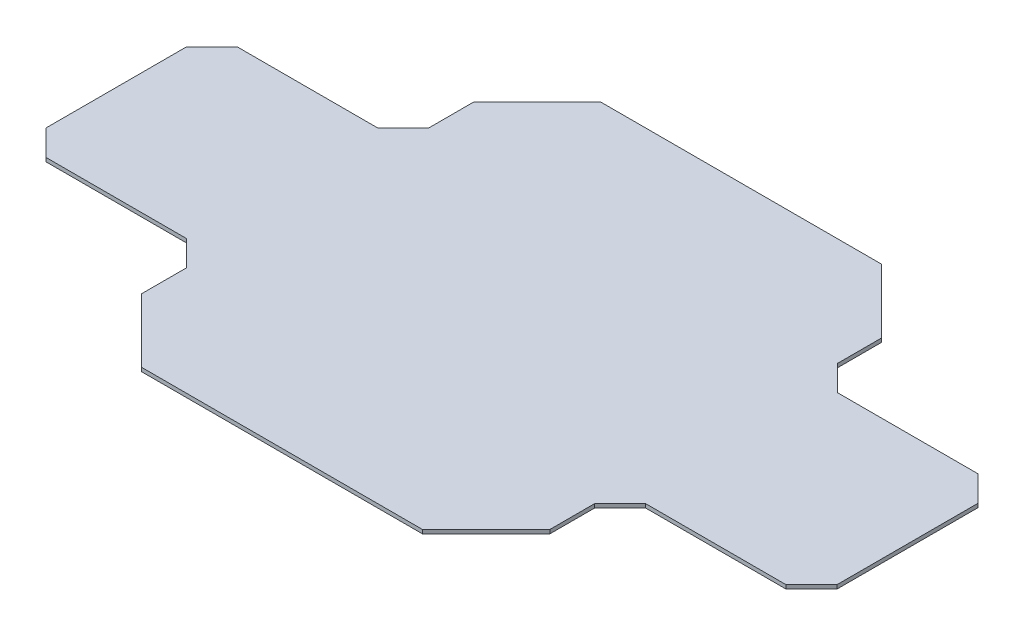
from build123d import *

# Parameters (mm, degrees)
EXTRUDE_1_DEPTH     = 3
CHAMFER_1_SIZE      = 20
SKETCH_2_W          = 320
SKETCH_2_H          = 20
CUT_EXTRUDE_1_DEPTH = 5
CHAMFER_2_SIZE      = 50


with BuildPart() as part:
    # 草图1 → 凸台-拉伸1 (new body)
    with BuildSketch(Plane(origin=(0, 0, 0), x_dir=(1, 0, 0), z_dir=(0, 1, 0))):
        Polygon((-310, -75), (-160, -75), (-160, -200), (160, -200), (160, -75), (310, -75), (310, 75.500128132), (160, 75.500128132), (160, 200), (-160, 200), (-160, 75), (-310, 75), align=None)
    extrude(amount=EXTRUDE_1_DEPTH)

    # 倒角1
    chamfer_1_edges = [part.edges().sort_by_distance(p)[0] for p in [
        (-160, 1.5, -75),
        (-310, 1.5, -75),
        (-310, 1.5, 75),
        (-160, 1.5, 75),
        (160, 1.5, 75),
        (160, 1.5, -75.500128132),
        (310, 1.5, 75),
        (310, 1.5, -75.500128132),
    ]]
    chamfer(chamfer_1_edges, length=CHAMFER_1_SIZE)

    # 草图2 → 切除-拉伸1 (cut)
    with BuildSketch(Plane(origin=(0, 3, 0), x_dir=(1, 0, 0), z_dir=(0, 1, 0))):
        with Locations((0, 190)):
            Rectangle(SKETCH_2_W, SKETCH_2_H)
        with Locations((0, -190)):
            Rectangle(SKETCH_2_W, SKETCH_2_H)
    extrude(amount=-CUT_EXTRUDE_1_DEPTH, mode=Mode.SUBTRACT)

    # 倒角2
    chamfer_2_edges = [part.edges().sort_by_distance(p)[0] for p in [
        (-160, 1.5, -180),
        (-160, 1.5, 180),
        (160, 1.5, -180),
        (160, 1.5, 180),
    ]]
    chamfer(chamfer_2_edges, length=CHAMFER_2_SIZE)


solid = part.part
